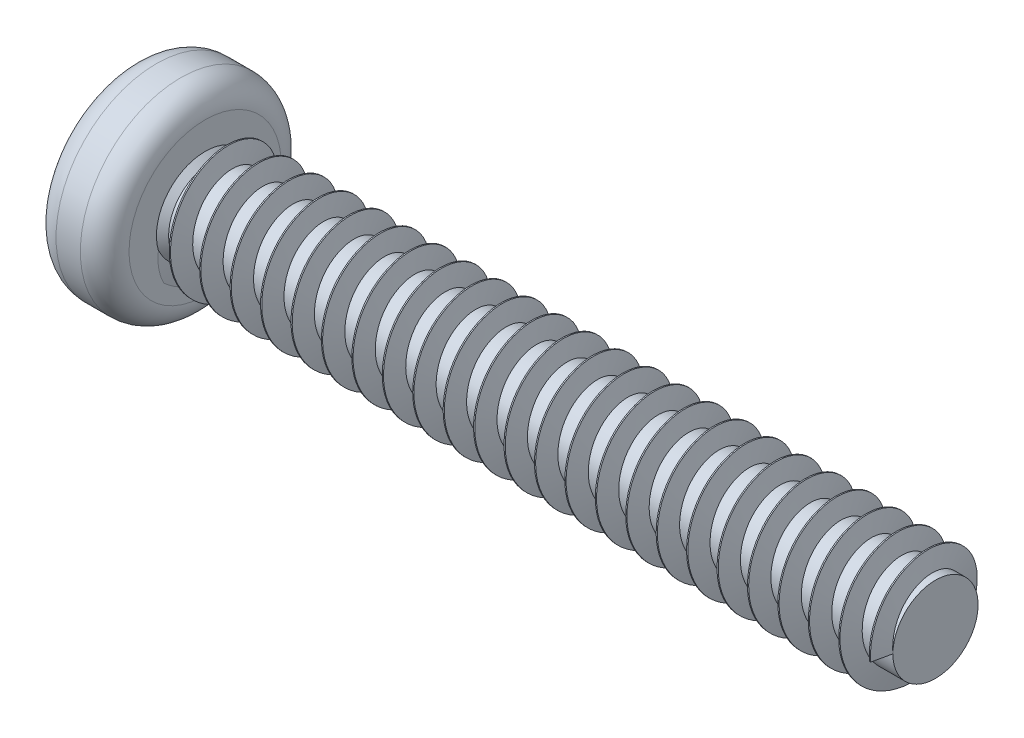
from build123d import *
from build123d.topology import SkipClean

# Parameters (mm, degrees)
SKETCH2_W                    = 0.4
SKETCH2_H                    = 1.7
CUT_EXTRUDE1_DEPTH           = 0.8
CUT_EXTRUDE1_DRAFT           = -9
SKETCH2_W_2                  = 1.7
SKETCH2_H_2                  = 0.4
CUT_EXTRUDE1_PROFILE_2_DEPTH = 0.8
CUT_EXTRUDE1_PROFILE_2_DRAFT = -9
THREAD3_PITCH                = 0.5


with BuildPart() as part:
    # Sketch1 → Revolve1 (revolve)
    with BuildSketch(Plane.XY):
        with BuildLine():
            Line((0, 0), (0, 1.25))
            ThreePointArc((0, 1.25), (0.117157288, 1.532842712), (0.4, 1.65))
            Line((0.4, 1.65), (0.8, 1.65))
            ThreePointArc((0.8, 1.65), (1.082842712, 1.532842712), (1.2, 1.25))
            Line((1.2, 1.25), (1.2, 0.8))
            Line((1.2, 0.8), (1.3, 0.7))
            Line((1.3, 0.7), (13.2, 0.7))
            Line((13.2, 0.7), (13.2, 0))
            Line((13.2, 0), (0, 0))
        make_face()
    revolve(axis=Axis((13.2, 0, 0), (-1, 0, 0)))


with BuildPart() as cut_extrude1_tool:
    # Sketch2 → Cut-Extrude1 (with draft: the straight prism first)
    with BuildSketch(Plane.ZY):
        Rectangle(SKETCH2_W, SKETCH2_H)
    extrude(amount=-CUT_EXTRUDE1_DEPTH)
    # Cut-Extrude1: the draft: its side faces are tilted about the plane it starts from
    cut_extrude1_sides = [cut_extrude1_tool.faces().sort_by_distance(p)[0] for p in [
        (0.4, 0, 0.2),
        (0.4, 0.85, 0),
        (0.4, 0, -0.2),
        (0.4, -0.85, 0),
    ]]
    draft(cut_extrude1_sides, Plane.ZY, CUT_EXTRUDE1_DRAFT)


with BuildPart() as part_1:
    add(part.part)

    # Cut-Extrude1: cut by cut_extrude1_tool
    add(cut_extrude1_tool.part, mode=Mode.SUBTRACT)


with BuildPart() as cut_extrude1_profile_2_tool:
    # Sketch2 → Cut-Extrude1 profile 2 (with draft: the straight prism first)
    with BuildSketch(Plane.ZY):
        Rectangle(SKETCH2_W_2, SKETCH2_H_2)
    extrude(amount=-CUT_EXTRUDE1_PROFILE_2_DEPTH)
    # Cut-Extrude1 profile 2: the draft: its side faces are tilted about the plane it starts from
    cut_extrude1_profile_2_sides = [cut_extrude1_profile_2_tool.faces().sort_by_distance(p)[0] for p in [
        (0.4, 0.2, 0),
        (0.4, 0, -0.85),
        (0.4, -0.2, 0),
        (0.4, 0, 0.85),
    ]]
    draft(cut_extrude1_profile_2_sides, Plane.ZY, CUT_EXTRUDE1_PROFILE_2_DRAFT)


with BuildPart() as part_2:
    add(part_1.part)

    # Cut-Extrude1 profile 2: cut by cut_extrude1_profile_2_tool
    add(cut_extrude1_profile_2_tool.part, mode=Mode.SUBTRACT)

    # Thread3: the profile of Thread Profile4 profile screwed along a right-hand helix of 24 turns, 6 arcs to a turn; built about Z, then put on its axis
    with SkipClean():  # the faces are left unmerged after this step: merging them gives an invalid solid
        thread3_z = Axis((0, 0, 0), (0, 0, 1))
        thread3_corners = [(0.6997, 0, -6.6508e-05), (1, 0, 0.066508399), (1, 0, 0.086508399), (0.6997, 0, 0.153083306)]
        with BuildLine(mode=Mode.PRIVATE) as thread3_profile:
            Line(thread3_corners[0], thread3_corners[1])
            Line(thread3_corners[1], thread3_corners[2])
            Line(thread3_corners[2], thread3_corners[3])
            Line(thread3_corners[3], thread3_corners[0])
        thread3_cap = Face(thread3_profile.wire())
        thread3_turn_angles = [0, 30, 60, 90, 120, 150, 180, 210, 240, 270, 300, 330, 360]
        thread3_turn_weights = [1, 0.8660254037844387, 1, 0.8660254037844387, 1, 0.8660254037844387, 1, 0.8660254037844387, 1, 0.8660254037844387, 1, 0.8660254037844387, 1]
        thread3_turn_rails = [Edge.make_bspline([Vector(p[0], p[1], 0).rotate(thread3_z, thread3_turn_angles[k]) / thread3_turn_weights[k] + Vector(0, 0, p[2] + THREAD3_PITCH * thread3_turn_angles[k] / 360) for k in range(13)], [0, 0, 0, 1, 1, 2, 2, 3, 3, 4, 4, 5, 5, 6, 6, 6], 2, thread3_turn_weights) for p in thread3_corners]
        thread3_turn_sides = [Face.make_surface_from_curves(thread3_turn_rails[p[0]], thread3_turn_rails[p[1]]) for p in [(0, 1), (1, 2), (2, 3), (3, 0)]]
        thread3 = Plane(origin=(13.2, 0, 0), x_dir=(0, 0, 1), z_dir=(-1, 0, 0)) * Solid(Shell([*[p.moved(Location((0, 0, THREAD3_PITCH * i))) for i in range(24) for p in thread3_turn_sides], thread3_cap, thread3_cap.rotate(thread3_z, 8640).moved(Location((0, 0, THREAD3_PITCH * 8640 / 360)))]))
        add(thread3)


solid = part_2.part
